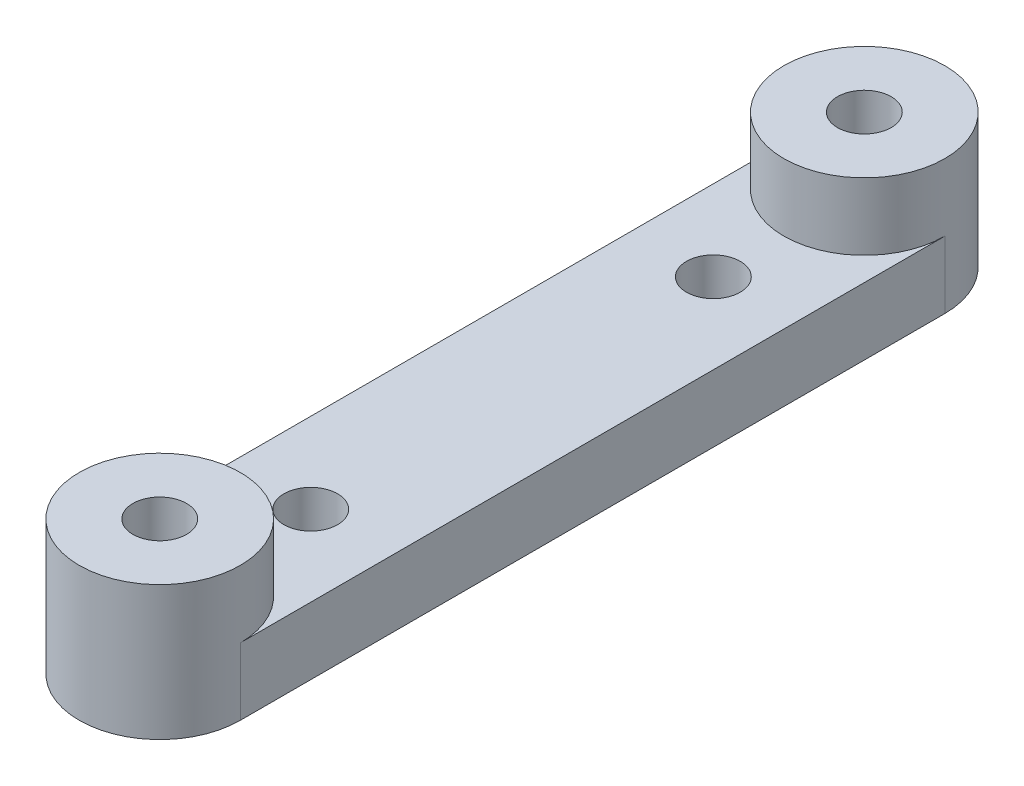
from build123d import *

# Parameters (mm, degrees)
SKETCH1_W           = 12
SKETCH1_H           = 64.5
BOSS_EXTRUDE1_DEPTH = 5
FILLET1_R           = 6
SKETCH2_R           = 2
CUT_EXTRUDE1_DEPTH  = 34.182261828
BOSS_EXTRUDE2_START = 5
SKETCH3_R           = 6
SKETCH3_R_2         = 2
BOSS_EXTRUDE2_DEPTH = 5
SKETCH4_R           = 2
CUT_EXTRUDE2_DEPTH  = 34.182261828
CUT_EXTRUDE3_DEPTH  = 2.5


with BuildPart() as part:
    # Sketch1 → Boss-Extrude1 (new body)
    with BuildSketch(Plane(origin=(0, 0, 0), x_dir=(1, 0, 0), z_dir=(0, 1, 0))):
        Rectangle(SKETCH1_W, SKETCH1_H)
    extrude(amount=BOSS_EXTRUDE1_DEPTH)

    # Fillet1
    fillet1_edges = [part.edges().sort_by_distance(p)[0] for p in [
        (-6, 2.5, -32.25),
        (6, 2.5, -32.25),
        (-6, 2.5, 32.25),
        (6, 2.5, 32.25),
    ]]
    fillet(fillet1_edges, radius=FILLET1_R - 0.0001)  # a hair under: the kernel refuses the full size

    # Sketch2 → Cut-Extrude1 (cut, through all)
    with BuildSketch(Plane(origin=(0, 5, 0), x_dir=(1, 0, 0), z_dir=(0, 1, 0))):
        with Locations(Location((0, -26.25, 0), (0, 0, 270))):
            Circle(SKETCH2_R)
        with Locations(Location((0, 26.25, 0), (0, 0, 270))):
            Circle(SKETCH2_R)
    extrude(amount=-CUT_EXTRUDE1_DEPTH, mode=Mode.SUBTRACT)

    # Sketch3 → Boss-Extrude2 (add)
    # profile 1 of 2: a face of its own
    with BuildSketch(Plane(origin=(0, 5, 0), x_dir=(1, 0, 0), z_dir=(0, 1, 0)).offset(BOSS_EXTRUDE2_START)):
        with Locations(Location((0, -26.25, 0), (0, 0, 270))):
            Circle(SKETCH3_R)
        with Locations(Location((0, -26.25, 0), (0, 0, 270))):
            Circle(SKETCH3_R_2, mode=Mode.SUBTRACT)
    # profile 2 of 2: a face of its own
    with BuildSketch(Plane(origin=(0, 5, 0), x_dir=(1, 0, 0), z_dir=(0, 1, 0)).offset(BOSS_EXTRUDE2_START)):
        with Locations(Location((0, 26.25, 0), (0, 0, 90))):
            Circle(SKETCH3_R)
        with Locations(Location((0, 26.25, 0), (0, 0, 270))):
            Circle(SKETCH3_R_2, mode=Mode.SUBTRACT)
    extrude(amount=-BOSS_EXTRUDE2_DEPTH)

    # Sketch4 → Cut-Extrude2 (cut, through all)
    with BuildSketch(Plane(origin=(0, 5, 0), x_dir=(1, 0, 0), z_dir=(0, 1, 0))):
        with Locations(Location((0, 15, 0), (0, 0, 270))):
            Circle(SKETCH4_R)
        with Locations(Location((0, -15, 0), (0, 0, 270))):
            Circle(SKETCH4_R)
    extrude(amount=-CUT_EXTRUDE2_DEPTH, mode=Mode.SUBTRACT)

    # Sketch5 → Cut-Extrude3 (cut)
    with BuildSketch(Plane.XZ):
        Polygon((4.618802154, 26.25), (2.309401077, 30.25), (-2.309401077, 30.25), (-4.618802154, 26.25), (-2.309401077, 22.25), (2.309401077, 22.25), align=None)
        Polygon((2.309401077, -22.25), (-2.309401077, -22.25), (-4.618802154, -26.25), (-2.309401077, -30.25), (2.309401077, -30.25), (4.618802154, -26.25), align=None)
    extrude(amount=-CUT_EXTRUDE3_DEPTH, mode=Mode.SUBTRACT)


solid = part.part
